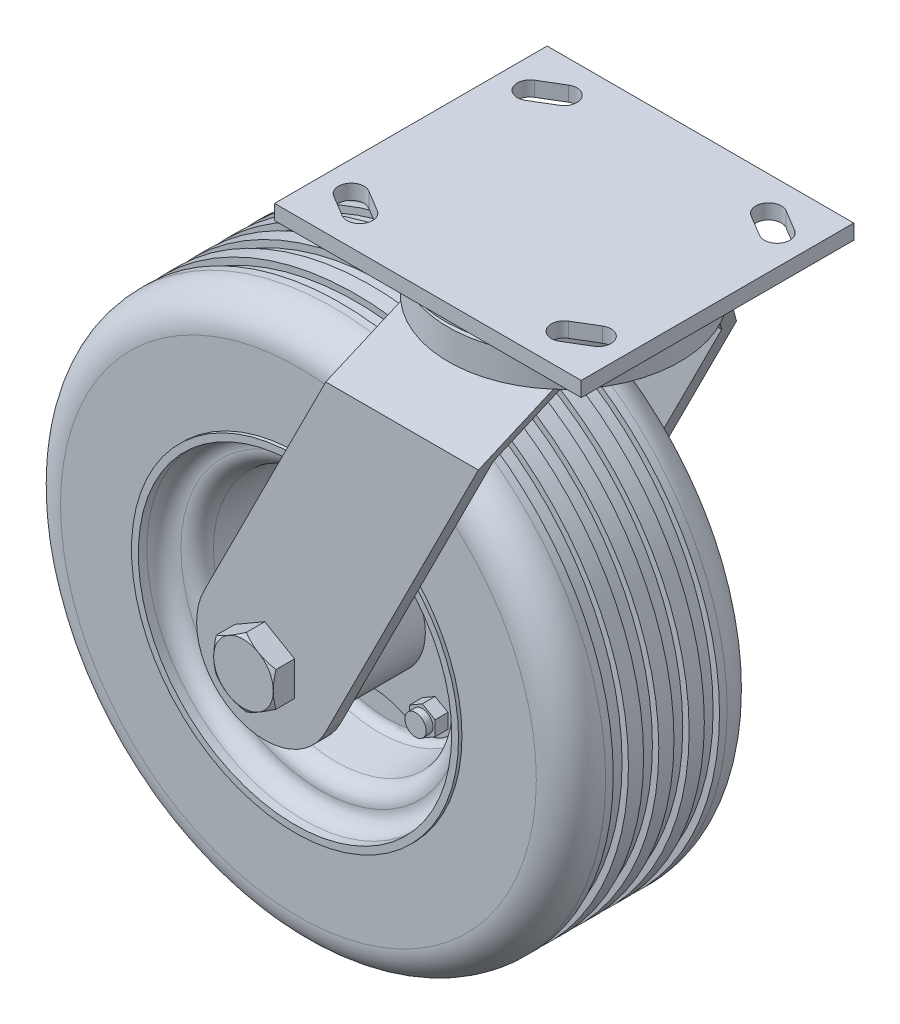
from build123d import *

# Parameters (mm, degrees)
SKETCH1_W               = 114.3
SKETCH1_H               = 5.55625
BOSS_EXTRUDE1_DEPTH     = 50.8
F_1_2_HOLES_DEPTH       = 77.66573168
BOSS_EXTRUDE5_DEPTH     = 6.35
BOSS_EXTRUDE6_DEPTH     = 4.7625
SKETCH15_R              = 3.96875
BOSS_EXTRUDE7_DEPTH     = 2.54
SKETCH16_R              = 6.35
BOSS_EXTRUDE8_DEPTH     = 4.7625
SKETCH7_W               = 193.541401884
SKETCH7_H               = 96.2152
BOSS_EXTRUDE2_DEPTH     = 227.64115
CUT_EXTRUDE1_START      = -96.2152
CUT_EXTRUDE1_DEPTH      = 96.2152
CUT_EXTRUDE3_DEPTH      = 226.084588196
CUT_EXTRUDE3_DEPTH_BACK = 226.084588196
SKETCH9_OUTSIDE_W       = 174.094
SKETCH9_OUTSIDE_H       = 326.494
BOSS_EXTRUDE3_DEPTH     = 7.9375
SKETCH11_OUTSIDE_W      = 1411.296
SKETCH11_OUTSIDE_H      = 1443.046
SKETCH11_OUTSIDE_R      = 11.1125
CUT_EXTRUDE4_DEPTH      = 322.231825002
CUT_EXTRUDE4_DRAFT      = -60
SKETCH12_R              = 10.795
BOSS_EXTRUDE4_DEPTH     = 85.1408


# Read off the part's stored shape, not the designer's step: Cut-Extrude1
with BuildPart() as part:
    # Sketch1 → Boss-Extrude1 (new, symmetric)
    with BuildSketch(Plane.XY):
        with Locations((0, -2.778125)):
            Rectangle(SKETCH1_W, SKETCH1_H)
    extrude(amount=BOSS_EXTRUDE1_DEPTH, both=True)

    # Sketch2 → 1-2 holes (cut, through all)
    with BuildSketch(Plane(origin=(0, 0, 0), x_dir=(1, 0, 0), z_dir=(0, 1, 0))):
        with BuildLine():
            Line((-35.649713965, 34.016189941), (-43.587213965, 29.253689941))
            ThreePointArc((-43.587213965, 29.253689941), (-50.121310059, 30.887213965), (-48.487786035, 37.421310059))
            Line((-48.487786035, 37.421310059), (-40.550286035, 42.183810059))
            ThreePointArc((-40.550286035, 42.183810059), (-34.016189941, 40.550286035), (-35.649713965, 34.016189941))
        make_face()
        with BuildLine():
            Line((-35.649713965, -34.016189941), (-43.587213965, -29.253689941))
            ThreePointArc((-43.587213965, -29.253689941), (-50.121310059, -30.887213965), (-48.487786035, -37.421310059))
            Line((-48.487786035, -37.421310059), (-40.550286035, -42.183810059))
            ThreePointArc((-40.550286035, -42.183810059), (-34.016189941, -40.550286035), (-35.649713965, -34.016189941))
        make_face()
        with BuildLine():
            Line((35.649713965, 34.016189941), (43.587213965, 29.253689941))
            ThreePointArc((43.587213965, 29.253689941), (50.121310059, 30.887213965), (48.487786035, 37.421310059))
            Line((48.487786035, 37.421310059), (40.550286035, 42.183810059))
            ThreePointArc((40.550286035, 42.183810059), (34.016189941, 40.550286035), (35.649713965, 34.016189941))
        make_face()
        with BuildLine():
            Line((35.649713965, -34.016189941), (43.587213965, -29.253689941))
            ThreePointArc((43.587213965, -29.253689941), (50.121310059, -30.887213965), (48.487786035, -37.421310059))
            Line((48.487786035, -37.421310059), (40.550286035, -42.183810059))
            ThreePointArc((40.550286035, -42.183810059), (34.016189941, -40.550286035), (35.649713965, -34.016189941))
        make_face()
    extrude(amount=-F_1_2_HOLES_DEPTH, mode=Mode.SUBTRACT)


with BuildPart() as body_2:
    # Sketch4 → Revolve1 (revolve)
    with BuildSketch(Plane.XY, mode=Mode.PRIVATE) as revolve1_sk:
        Polygon((0, -26.35885), (43.18, -26.35885), (43.18, -15.24635), (40.64, -15.24635), (40.64, -12.70635), (44.45, -12.70635), (44.45, -5.55625), (0, -5.55625), align=None)
    revolve(revolve1_sk.sketch.rotate(Axis((0, -5.55625, 0), (0, -1, 0)), 180), axis=Axis((0, -5.55625, 0), (0, -1, 0)))


with BuildPart() as body_3:
    # Sketch6 → Revolve2 (revolve)
    with BuildSketch(Plane(origin=(-63.5, 0, 0), x_dir=(0, 0, -1), z_dir=(1, 0, 0)), mode=Mode.PRIVATE) as revolve2_sk:
        with BuildLine():
            Line((-35.56, -91.44), (-35.56, -63.730909091))
            ThreePointArc((-35.56, -63.730909091), (-31.772624414, -54.587375586), (-22.629090909, -50.8))
            Line((-22.629090909, -50.8), (-19.800454545, -50.8))
            Line((-19.800454545, -50.8), (-19.800454545, -53.18125))
            Line((-19.800454545, -53.18125), (-14.143181818, -53.18125))
            Line((-14.143181818, -53.18125), (-14.143181818, -50.8))
            Line((-14.143181818, -50.8), (-8.485909091, -50.8))
            Line((-8.485909091, -50.8), (-8.485909091, -53.18125))
            Line((-8.485909091, -53.18125), (-2.828636364, -53.18125))
            Line((-2.828636364, -53.18125), (-2.828636364, -50.8))
            Line((-2.828636364, -50.8), (2.828636364, -50.8))
            Line((2.828636364, -50.8), (2.828636364, -53.18125))
            Line((2.828636364, -53.18125), (8.485909091, -53.18125))
            Line((8.485909091, -53.18125), (8.485909091, -50.8))
            Line((8.485909091, -50.8), (14.143181818, -50.8))
            Line((14.143181818, -50.8), (14.143181818, -53.18125))
            Line((14.143181818, -53.18125), (19.800454545, -53.18125))
            Line((19.800454545, -53.18125), (19.800454545, -50.8))
            Line((19.800454545, -50.8), (22.629090909, -50.8))
            ThreePointArc((22.629090909, -50.8), (31.772624414, -54.587375586), (35.56, -63.730909091))
            Line((35.56, -63.730909091), (35.56, -91.44))
            Line((35.56, -91.44), (36.83, -91.44))
            Line((36.83, -91.44), (36.83, -93.98))
            Line((36.83, -93.98), (33.655, -93.98))
            ThreePointArc((33.655, -93.98), (29.164871939, -95.839871939), (27.305, -100.33))
            ThreePointArc((27.305, -100.33), (25.636711089, -104.619997818), (21.508438966, -106.655836333))
            Line((21.508438966, -106.655836333), (5.438280517, -108.061793018))
            ThreePointArc((5.438280517, -108.061793018), (3.374144456, -109.079712276), (2.54, -111.224711185))
            Line((2.54, -111.224711185), (2.54, -131.7625))
            Line((2.54, -131.7625), (36.83, -131.7625))
            Line((36.83, -131.7625), (40.005, -131.7625))
            Line((40.005, -131.7625), (40.005, -152.4))
            Line((40.005, -152.4), (-40.005, -152.4))
            Line((-40.005, -152.4), (-40.005, -131.7625))
            Line((-40.005, -131.7625), (-36.83, -131.7625))
            Line((-36.83, -131.7625), (-2.54, -131.7625))
            Line((-2.54, -131.7625), (-2.54, -111.224711185))
            ThreePointArc((-2.54, -111.224711185), (-3.374144456, -109.079712276), (-5.438280517, -108.061793018))
            Line((-5.438280517, -108.061793018), (-21.508438966, -106.655836333))
            ThreePointArc((-21.508438966, -106.655836333), (-25.636711089, -104.619997818), (-27.305, -100.33))
            ThreePointArc((-27.305, -100.33), (-29.164871939, -95.839871939), (-33.655, -93.98))
            Line((-33.655, -93.98), (-36.83, -93.98))
            Line((-36.83, -93.98), (-36.83, -91.44))
            Line((-36.83, -91.44), (-35.56, -91.44))
        make_face()
    revolve(revolve2_sk.sketch.rotate(Axis((-63.5, -152.4, 111.145303652), (0, 0, -1)), 90), axis=Axis((-63.5, -152.4, 111.145303652), (0, 0, -1)))

    # Sketch13 → Boss-Extrude5 (add)
    with BuildSketch(Plane.XY.offset(2.54)):
        with BuildLine():
            ThreePointArc((-94.691813407, -138.062089407), (-92.615325939, -123.284674061), (-77.837910593, -121.208186593))
            ThreePointArc((-77.837910593, -121.208186593), (-63.5, -124.916570395), (-49.162089407, -121.208186593))
            ThreePointArc((-49.162089407, -121.208186593), (-34.384674061, -123.284674061), (-32.308186593, -138.062089407))
            ThreePointArc((-32.308186593, -138.062089407), (-36.016570395, -152.4), (-32.308186593, -166.737910593))
            ThreePointArc((-32.308186593, -166.737910593), (-34.384674061, -181.515325939), (-49.162089407, -183.591813407))
            ThreePointArc((-49.162089407, -183.591813407), (-63.5, -179.883429605), (-77.837910593, -183.591813407))
            ThreePointArc((-77.837910593, -183.591813407), (-92.615325939, -181.515325939), (-94.691813407, -166.737910593))
            ThreePointArc((-94.691813407, -166.737910593), (-90.983429605, -152.4), (-94.691813407, -138.062089407))
        make_face()
    extrude(amount=BOSS_EXTRUDE5_DEPTH)

    # Sketch14 → Boss-Extrude6 (add)
    with BuildSketch(Plane.XY.offset(8.89)):
        Polygon((-87.774522691, -122.626215995), (-83.012022691, -125.375846652), (-83.012022691, -130.875107966), (-87.774522691, -133.624738623), (-92.537022691, -130.875107966), (-92.537022691, -125.375846652), align=None)
        Polygon((-34.462977309, -125.375846652), (-39.225477309, -122.626215995), (-43.987977309, -125.375846652), (-43.987977309, -130.875107966), (-39.225477309, -133.624738623), (-34.462977309, -130.875107966), align=None)
        Polygon((-39.225477309, -182.173784005), (-43.987977309, -179.424153348), (-43.987977309, -173.924892034), (-39.225477309, -171.175261377), (-34.462977309, -173.924892034), (-34.462977309, -179.424153348), align=None)
        Polygon((-92.537022691, -179.424153348), (-87.774522691, -182.173784005), (-83.012022691, -179.424153348), (-83.012022691, -173.924892034), (-87.774522691, -171.175261377), (-92.537022691, -173.924892034), align=None)
    extrude(amount=BOSS_EXTRUDE6_DEPTH)

    # Sketch15 → Boss-Extrude7 (add)
    with BuildSketch(Plane.XY.offset(13.6525)):
        with Locations(Location((-87.774522691, -128.125477309, 0), (0, 0, 180))):
            Circle(SKETCH15_R)
        with Locations((-39.225477309, -128.125477309)):
            Circle(SKETCH15_R)
        with Locations((-87.774522691, -176.674522691)):
            Circle(SKETCH15_R)
        with Locations(Location((-39.225477309, -176.674522691, 0), (0, 0, 180))):
            Circle(SKETCH15_R)
    extrude(amount=BOSS_EXTRUDE7_DEPTH)

    # Sketch16 → Boss-Extrude8 (add)
    with BuildSketch(Plane(origin=(0, 0, -2.54), x_dir=(-1, 0, 0), z_dir=(0, 0, -1))):
        with Locations(Location((39.225477309, -128.125477309, 0), (0, 0, 180))):
            Circle(SKETCH16_R)
        with Locations(Location((87.774522691, -128.125477309, 0), (0, 0, 180))):
            Circle(SKETCH16_R)
        with Locations(Location((87.774522691, -176.674522691, 0), (0, 0, 180))):
            Circle(SKETCH16_R)
        with Locations(Location((39.225477309, -176.674522691, 0), (0, 0, 180))):
            Circle(SKETCH16_R)
    extrude(amount=BOSS_EXTRUDE8_DEPTH)


with BuildPart() as body_4:
    # Sketch7 → Boss-Extrude2 (new body)
    with BuildSketch(Plane.XZ.offset(26.35885)):
        with Locations((-68.329299058, 0)):
            Rectangle(SKETCH7_W, SKETCH7_H)
    extrude(amount=BOSS_EXTRUDE2_DEPTH)

    # Cut-Extrude1 outline → Cut-Extrude1 (cut)
    with BuildSketch(Plane.XY.offset(48.1076).offset(CUT_EXTRUDE1_START)):
        with BuildLine():
            Line((28.441401884, -26.35885), (-40.816167373, -163.828199218))
            ThreePointArc((-40.816167373, -163.828199218), (-74.928199218, -175.083832627), (-86.183832627, -140.971800782))
            Line((-86.183832627, -140.971800782), (-28.441401884, -26.35885))
            Line((-28.441401884, -26.35885), (-165.1, -26.35885))
            Line((-165.1, -26.35885), (-165.1, -254))
            Line((-165.1, -254), (28.441401884, -254))
            Line((28.441401884, -254), (28.441401884, -26.35885))
        make_face()
    extrude(amount=CUT_EXTRUDE1_DEPTH, mode=Mode.SUBTRACT)

    # Sketch9 outside → Cut-Extrude3 (cut, two sides: drawn at the far end of the back side and taken through both)
    with BuildSketch(Plane(origin=(0, -144.306693689, 0), x_dir=(0, 0, -1), z_dir=(-1, 0, 0)).offset(-CUT_EXTRUDE3_DEPTH_BACK)):
        with Locations((0, -17.307)):
            Rectangle(SKETCH9_OUTSIDE_W, SKETCH9_OUTSIDE_H)
        Polygon((48.1076, 109.693306311), (48.1076, -93.506693689), (32.489983978, -117.947843689), (26.952783978, -117.947843689), (42.5704, -93.506693689), (42.5704, 109.693306311), align=None, mode=Mode.SUBTRACT)
        Polygon((-26.952783978, -117.947843689), (-32.489983978, -117.947843689), (-48.1076, -93.506693689), (-48.1076, 109.693306311), (-42.5704, 109.693306311), (-42.5704, -93.506693689), align=None, mode=Mode.SUBTRACT)
    extrude(amount=CUT_EXTRUDE3_DEPTH + CUT_EXTRUDE3_DEPTH_BACK, mode=Mode.SUBTRACT)


with BuildPart() as cut_extrude3_piece_1:
    # of the separate pieces the step leaves, piece 1, a body of its own (cut_extrude3_pieces)
    add(body_4.part.solids().sort_by_distance((16.12785964, -50.8, 48.1076))[0])



with BuildPart() as cut_extrude3_piece_2:
    # of the separate pieces the step leaves, piece 2, a body of its own (cut_extrude3_pieces)
    add(body_4.part.solids().sort_by_distance((28.441401884, -26.35885, -32.489983978))[0])


with BuildPart() as body_6:
    # Sketch10 → Boss-Extrude3 (new body)
    with BuildSketch(Plane.XY.offset(48.1076)):
        Polygon((-63.5, -139.568390267), (-74.6125, -145.984195134), (-74.6125, -158.815804866), (-63.5, -165.231609733), (-52.3875, -158.815804866), (-52.3875, -145.984195134), align=None)
    extrude(amount=BOSS_EXTRUDE3_DEPTH)


with BuildPart() as cut_extrude4_tool:
    # Sketch11 outside → Cut-Extrude4 (with draft: the straight prism first)
    with BuildSketch(Plane.XY.offset(56.0451)):
        with Locations((-53.975, -127)):
            Rectangle(SKETCH11_OUTSIDE_W, SKETCH11_OUTSIDE_H)
        with Locations((-63.5, -152.4)):
            Circle(SKETCH11_OUTSIDE_R, mode=Mode.SUBTRACT)
    extrude(amount=-CUT_EXTRUDE4_DEPTH)
    # Cut-Extrude4: the draft: its side faces are tilted about the plane it starts from
    cut_extrude4_sides = [cut_extrude4_tool.faces().sort_by_distance(p)[0] for p in [
        (-53.975, -848.523, -105.070812501),
        (651.673, -127, -105.070812501),
        (-53.975, 594.523, -105.070812501),
        (-759.623, -127, -105.070812501),
        (-74.6125, -152.4, -105.070812501),
    ]]
    draft(cut_extrude4_sides, Plane.XY.offset(56.0451), CUT_EXTRUDE4_DRAFT)


with BuildPart() as body_6_1:
    add(body_6.part)

    # Cut-Extrude4: cut by cut_extrude4_tool
    add(cut_extrude4_tool.part, mode=Mode.SUBTRACT)


with BuildPart() as body_7:
    # Mirror1: mirrored copy
    add(body_6_1.part.mirror(Plane.XY))


with BuildPart() as cut_extrude3_piece_1_1:
    add(cut_extrude3_piece_1.part)

    add(cut_extrude3_piece_2.part)  # Boss-Extrude4 merges Cut-Extrude3 piece 2
    # Sketch12 → Boss-Extrude4 (add)
    with BuildSketch(Plane.XY.offset(-42.5704)):
        with Locations(Location((-63.5, -152.4, 0), (0, 0, 180))):
            Circle(SKETCH12_R)
    extrude(amount=BOSS_EXTRUDE4_DEPTH)

    # Combine1: union body 7, body 6, body 2, part
    add(body_7.part)
    add(body_6_1.part)
    add(body_2.part)
    add(part.part)


solid = Compound([body_3.part, cut_extrude3_piece_1_1.part])
